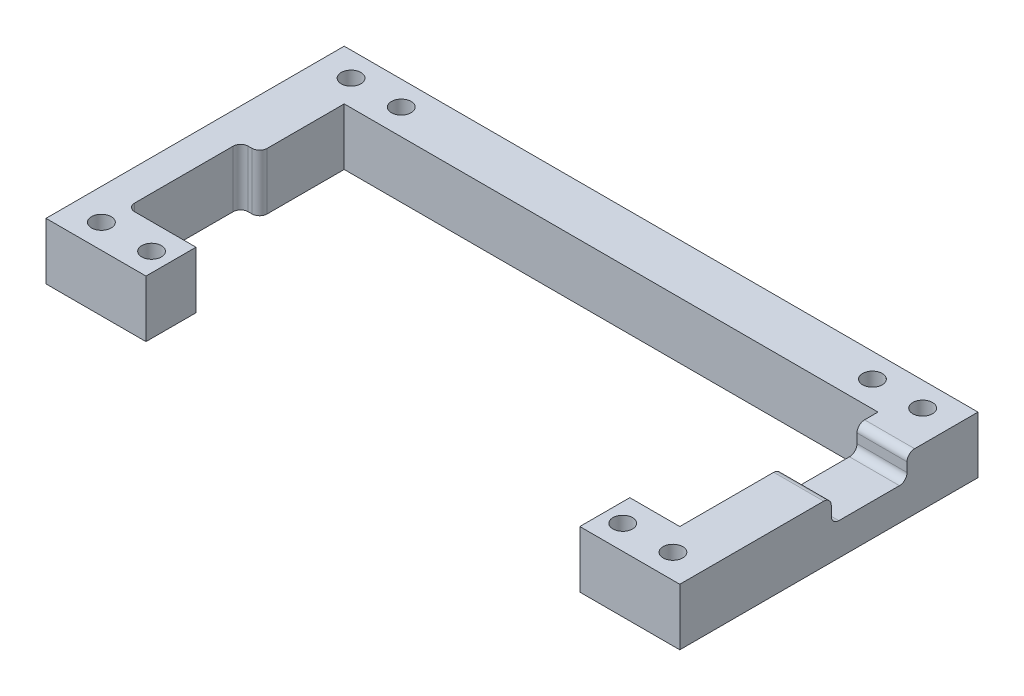
from build123d import *

# Parameters (mm, degrees)
SKETCH1_R           = 1.651
BOSS_EXTRUDE1_DEPTH = 9.525
SKETCH2_W           = 12.7
SKETCH2_H           = 4.099575227
CUT_EXTRUDE7_DEPTH  = 8.89
FILLET2_R           = 1.27
SKETCH4_W           = 3.175
SKETCH4_H           = 19.05
CUT_EXTRUDE8_DEPTH  = 192.957337147
FILLET3_R           = 1.27


with BuildPart() as part:
    # Sketch1 → Boss-Extrude1 (new body)
    with BuildSketch(Plane(origin=(0, 0, 0), x_dir=(1, 0, 0), z_dir=(0, 1, 0))):
        Polygon((75.155177047, 61.997896552), (75.155177047, 11.997896552), (91.919177047, 11.997896552), (91.919177047, 20.379896552), (83.537177047, 20.379896552), (83.537177047, 53.615896552), (173.037829354, 53.615896552), (173.037829354, 20.379896552), (164.655829354, 20.379896552), (164.655829354, 11.997896552), (181.419829354, 11.997896552), (181.419829354, 61.997896552), align=None)
        with Locations((80.3721812, 16.064784874)):
            Circle(SKETCH1_R, mode=Mode.SUBTRACT)
        with Locations((80.3721812, 57.93100823)):
            Circle(SKETCH1_R, mode=Mode.SUBTRACT)
        with Locations((167.7875512, 57.93100823)):
            Circle(SKETCH1_R, mode=Mode.SUBTRACT)
        with Locations((88.7874552, 57.93100823)):
            Circle(SKETCH1_R, mode=Mode.SUBTRACT)
        with Locations((88.7874552, 16.064784874)):
            Circle(SKETCH1_R, mode=Mode.SUBTRACT)
        with Locations((176.2028252, 57.93100823)):
            Circle(SKETCH1_R, mode=Mode.SUBTRACT)
        with Locations((176.2028252, 16.064784874)):
            Circle(SKETCH1_R, mode=Mode.SUBTRACT)
        with Locations((167.7875512, 16.064784874)):
            Circle(SKETCH1_R, mode=Mode.SUBTRACT)
    extrude(amount=BOSS_EXTRUDE1_DEPTH)

    # Sketch2 → Cut-Extrude7 (cut)
    with BuildSketch(Plane(origin=(181.419829354, 0, 0), x_dir=(0, 0, -1), z_dir=(1, 0, 0))):
        with Locations((43.747896552, 7.475212387)):
            Rectangle(SKETCH2_W, SKETCH2_H)
    extrude(amount=-CUT_EXTRUDE7_DEPTH, mode=Mode.SUBTRACT)

    # Fillet2
    fillet2_edges = [part.edges().sort_by_distance(p)[0] for p in [
        (177.228829354, 5.425424773, -37.397896552),
        (177.228829354, 9.525, -37.397896552),
        (177.228829354, 9.525, -50.097896552),
        (177.228829354, 5.425424773, -50.097896552),
    ]]
    fillet(fillet2_edges, radius=FILLET2_R)

    # Sketch4 → Cut-Extrude8 (cut, through all)
    with BuildSketch(Plane(origin=(0, 9.525, 0), x_dir=(1, 0, 0), z_dir=(0, 1, 0))):
        with Locations((81.949677047, 29.904896552)):
            Rectangle(SKETCH4_W, SKETCH4_H)
    extrude(amount=-CUT_EXTRUDE8_DEPTH, mode=Mode.SUBTRACT)

    # Fillet3
    fillet3_edges = [part.edges().sort_by_distance(p)[0] for p in [
        (80.362177047, 4.7625, -20.379896552),
        (80.362177047, 4.7625, -39.429896552),
        (83.537177047, 4.7625, -39.429896552),
    ]]
    fillet(fillet3_edges, radius=FILLET3_R)


solid = part.part
